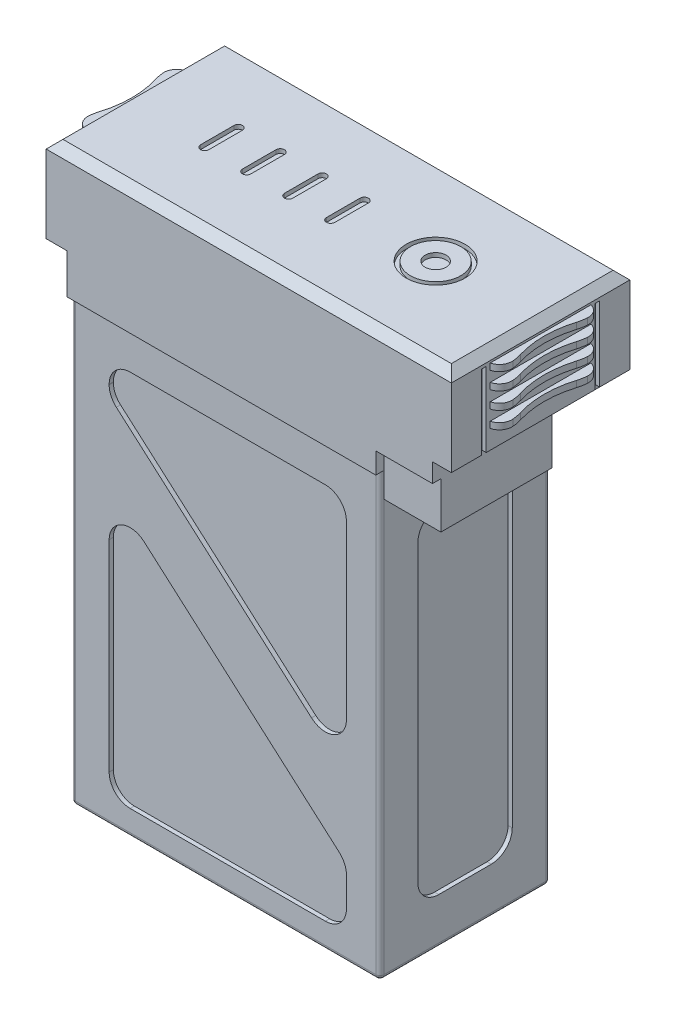
from build123d import *

# Parameters (mm, degrees)
SKETCH_1_W           = 73.5
SKETCH_1_H           = 40.5
EXTRUDE_1_DEPTH      = 135
EXTRUDE_2_DEPTH      = 1
EXTRUDE_3_DEPTH      = 1
OTHER_START          = 114.5
OTHER_1_OUTLINE_W    = 18
OTHER_1_OUTLINE_H    = 40.5
OTHER_1_DEPTH        = 20.5
OTHER_START_2        = 110
OTHER_1_2_OUTLINE_W  = 13.5
OTHER_1_2_OUTLINE_H  = 40.5
OTHER_1_2_DEPTH      = 4.5
OTHER_START_3        = -41.75
OTHER_2_OUTLINE_W    = 20.5
OTHER_2_OUTLINE_H    = 40.5
OTHER_2_DEPTH        = 5
SKETCH_4_W           = 24
SKETCH_4_H           = 1.5
EXTRUDE_4_DEPTH      = 2.3
SKETCH_5_W           = 24
SKETCH_5_H           = 1.5
EXTRUDE_5_DEPTH      = 2.3
CUT_EXTRUDE_1_DEPTH  = 18
CUT_EXTRUDE_2_DEPTH  = 18
FILLET_1_R           = 10
FILLET_2_R           = 10
FILLET_3_R           = 3
FILLET_4_R           = 3
CHAMFER_1_SIZE       = 2
SKETCH_8_W           = 1.109210869
SKETCH_8_H           = 17.780563028
CUT_EXTRUDE_3_DEPTH  = 1
SKETCH_9_W           = 1.109210869
SKETCH_9_H           = 17.780563028
CUT_EXTRUDE_4_DEPTH  = 1
FILLET_5_R           = 1
FILLET_6_R           = 1
SKETCH_10_W          = 13.5
SKETCH_10_H          = 26.5
EXTRUDE_6_DEPTH      = 11
SKETCH_11_W          = 3.601924373
SKETCH_11_H          = 6.553501289
CUT_EXTRUDE_5_DEPTH  = 11
CUT_EXTRUDE_6_DEPTH  = 1
CUT_EXTRUDE_START    = -1
CUT_EXTRUDE_7_DEPTH  = 1
CUT_EXTRUDE_8_DEPTH  = 1
CUT_EXTRUDE_9_DEPTH  = 1
SKETCH_16_R          = 7
SKETCH_16_R_2        = 6
CUT_EXTRUDE_10_DEPTH = 1
SKETCH_20_R          = 2.5
CUT_EXTRUDE_11_DEPTH = 1


# Read off the part's stored shape, not the designer's step: 边界1, 边界2
with BuildPart() as part:
    # 草图1 → 凸台-拉伸1 (new body)
    with BuildSketch(Plane(origin=(0, 0, 0), x_dir=(1, 0, 0), z_dir=(0, 1, 0))):
        Rectangle(SKETCH_1_W, SKETCH_1_H)
    extrude(amount=EXTRUDE_1_DEPTH)

    # 草图2 → 凸台-拉伸2 (add)
    with BuildSketch(Plane.XY.offset(20.25)):
        Polygon((36.75, 135), (54.75, 135), (54.75, 114.5), (50.25, 114.5), (50.25, 110), (36.75, 110), (36.75, 105), (-21.75311528, 105), (-36.75, 105), (-36.75, 114.5), (-41.75, 114.5), (-41.75, 135), (-36.75, 135), align=None)
    extrude(amount=EXTRUDE_2_DEPTH)

    # 草图3 → 凸台-拉伸3 (add)
    with BuildSketch(Plane(origin=(0, 0, -20.25), x_dir=(-1, 0, 0), z_dir=(0, 0, -1))):
        Polygon((41.75, 135), (-54.75, 135), (-54.75, 114.5), (-50.25, 114.5), (-50.25, 110), (-36.75, 110), (-36.75, 105), (36.75, 105), (36.75, 114.5), (41.75, 114.5), align=None)
    extrude(amount=EXTRUDE_3_DEPTH)

    # 边界1 outline → 边界1 (add)
    with BuildSketch(Plane(origin=(0, 0, 0), x_dir=(1, 0, 0), z_dir=(0, 1, 0)).offset(OTHER_START)):
        with Locations((45.75, 0)):
            Rectangle(OTHER_1_OUTLINE_W, OTHER_1_OUTLINE_H)
    extrude(amount=OTHER_1_DEPTH)

    # Other 1 2 outline → Other 1 2 (add)
    with BuildSketch(Plane(origin=(0, 0, 0), x_dir=(1, 0, 0), z_dir=(0, 1, 0)).offset(OTHER_START_2)):
        with Locations((43.5, 0)):
            Rectangle(OTHER_1_2_OUTLINE_W, OTHER_1_2_OUTLINE_H)
    extrude(amount=OTHER_1_2_DEPTH)

    # 边界2 outline → 边界2 (add)
    with BuildSketch(Plane.YZ.offset(OTHER_START_3)):
        with Locations((124.75, 0)):
            Rectangle(OTHER_2_OUTLINE_W, OTHER_2_OUTLINE_H)
    extrude(amount=OTHER_2_DEPTH)

    # 草图4 → 凸台-拉伸4 (add)
    with BuildSketch(Plane(origin=(54.75, 0, 0), x_dir=(0, 0, -1), z_dir=(1, 0, 0))):
        with Locations((0, 131.75)):
            Rectangle(SKETCH_4_W, SKETCH_4_H)
        with Locations((0, 127.75)):
            Rectangle(SKETCH_4_W, SKETCH_4_H)
        with Locations((0, 123.75)):
            Rectangle(SKETCH_4_W, SKETCH_4_H)
        with Locations((0, 119.75)):
            Rectangle(SKETCH_4_W, SKETCH_4_H)
    extrude(amount=EXTRUDE_4_DEPTH)

    # 草图5 → 凸台-拉伸5 (add)
    with BuildSketch(Plane.ZY.offset(41.75)):
        with Locations((0, 131.75)):
            Rectangle(SKETCH_5_W, SKETCH_5_H)
        with Locations((0, 123.75)):
            Rectangle(SKETCH_5_W, SKETCH_5_H)
        with Locations((0, 127.75)):
            Rectangle(SKETCH_5_W, SKETCH_5_H)
        with Locations((0, 119.75)):
            Rectangle(SKETCH_5_W, SKETCH_5_H)
    extrude(amount=EXTRUDE_5_DEPTH)

    # 草图6 → 切除-拉伸1 (cut)
    with BuildSketch(Plane(origin=(0, 132.5, 0), x_dir=(1, 0, 0), z_dir=(0, 1, 0))):
        with BuildLine():
            Line((-44.05, 8), (-44.05, -8))
            ThreePointArc((-44.05, -8), (-42.613858653, 0), (-44.05, 8))
        make_face()
    extrude(amount=-CUT_EXTRUDE_1_DEPTH, mode=Mode.SUBTRACT)

    # 草图7 → 切除-拉伸2 (cut)
    with BuildSketch(Plane(origin=(0, 132.5, 0), x_dir=(1, 0, 0), z_dir=(0, 1, 0))):
        with BuildLine():
            Line((57.05, 8), (57.05, -8))
            ThreePointArc((57.05, -8), (55.613858653, 0), (57.05, 8))
        make_face()
    extrude(amount=-CUT_EXTRUDE_2_DEPTH, mode=Mode.SUBTRACT)

    # 圆角1
    fillet_1_edges = [part.edges().sort_by_distance(p)[0] for p in [
        (57.05, 119.75, 8),
        (57.05, 119.75, -8),
        (57.05, 131.75, -8),
        (57.05, 127.75, -8),
        (57.05, 123.75, -8),
        (57.05, 131.75, 8),
        (57.05, 127.75, 8),
        (57.05, 123.75, 8),
    ]]
    fillet(fillet_1_edges, radius=FILLET_1_R)

    # 圆角2
    fillet_2_edges = [part.edges().sort_by_distance(p)[0] for p in [
        (-44.05, 119.75, -8),
        (-44.05, 119.75, 8),
        (-44.05, 131.75, 8),
        (-44.05, 127.75, 8),
        (-44.05, 123.75, 8),
        (-44.05, 131.75, -8),
        (-44.05, 127.75, -8),
        (-44.05, 123.75, -8),
    ]]
    fillet(fillet_2_edges, radius=FILLET_2_R)

    # 圆角3
    # the kernel refuses this fillet: 3 mm, written as the material it takes off along each edge
    with BuildSketch(Plane(origin=(-44.05, 123.139425888, 12), x_dir=(1, 0, 0), z_dir=(0, 1, 0)), Plane(origin=(-44.05, 119.139425888, 12), x_dir=(1, 0, 0), z_dir=(0, 1, 0)), Plane(origin=(-44.05, 111.139425888, 12), x_dir=(1, 0, 0), z_dir=(0, 1, 0)), Plane(origin=(-44.05, 136.360574112, -12), x_dir=(1, 0, 0), z_dir=(0, -1, 0)), Plane(origin=(-44.05, 140.360574112, -12), x_dir=(1, 0, 0), z_dir=(0, -1, 0))) as fillet_3_piece_1:
        with BuildLine():
            CenterArc((3.020964191, 2.912080122), FILLET_3_R, 175.564566075, 80.529923678)
            Line((0.029948845, 3.14408701), (-0.26915269, 3.167287699))
            ThreePointArc((-0.26915269, 3.167287699), (-0.3, 2.370730716), (-0.3, 0))
            Line((-0.3, 0), (0, -0.3))
            ThreePointArc((0, -0.3), (1.15, -0.3), (2.227903581, -0.291208012))
            Line((2.227903581, -0.291208012), (2.3, 0))
        make_face()
    extrude(amount=17.221148223, mode=Mode.SUBTRACT)
    with BuildSketch(Plane(origin=(-44.05, 132.360574112, 12), x_dir=(1, 0, 0), z_dir=(0, -1, 0)), Plane(origin=(-44.05, 115.139425888, -12), x_dir=(1, 0, 0), z_dir=(0, 1, 0))) as fillet_3_piece_2:
        with BuildLine():
            CenterArc((3.020964191, -2.912080122), FILLET_3_R, 103.905510246, 80.529923678)
            Line((0.029948845, -3.14408701), (-0.26915269, -3.167287699))
            ThreePointArc((-0.26915269, -3.167287699), (-0.3, -2.370730716), (-0.3, 0))
            Line((-0.3, 0), (0, 0.3))
            ThreePointArc((0, 0.3), (1.15, 0.3), (2.227903581, 0.291208012))
            Line((2.227903581, 0.291208012), (2.3, 0))
        make_face()
    extrude(amount=17.221148223, mode=Mode.SUBTRACT)
    with BuildSketch(Plane(origin=(-44.05, 128.360574112, -12), x_dir=(0.009525018177513691, 0, 0.9999546359854121), z_dir=(0, -1, 0))) as fillet_3_piece_3:
        with BuildLine():
            CenterArc((2.940722757, -2.993089532), FILLET_3_R, 86.110317669, 80.529923678)
            Line((0.021907542, -2.299895663), (-0.26997398, -2.230576276))
            ThreePointArc((-0.26997398, -2.230576276), (-0.28903262, -1.152805337), (-0.299986391, -0.002857505))
            Line((-0.299986391, -0.002857505), (-0.002857505, 0.299986391))
            ThreePointArc((-0.002857505, 0.299986391), (2.367765665, 0.322567644), (3.164580333, 0.299308953))
            Line((3.164580333, 0.299308953), (3.144229645, 0))
        make_face()
    extrude(amount=17.221148223, mode=Mode.SUBTRACT)

    # 圆角4
    # the kernel refuses this fillet: 3 mm, written as the material it takes off along each edge
    with BuildSketch(Plane(origin=(57.05, 140.360574112, 12), x_dir=(-0.009525018177511517, 1.1841841711484496e-15, -0.9999546359854121), z_dir=(0, -1, 0))) as fillet_4_piece_1:
        with BuildLine():
            CenterArc((2.940722757, -2.993089532), FILLET_4_R, 86.110317669, 80.529923678)
            Line((0.021907542, -2.299895663), (-0.26997398, -2.230576276))
            ThreePointArc((-0.26997398, -2.230576276), (-0.28903262, -1.152805337), (-0.299986391, -0.002857505))
            Line((-0.299986391, -0.002857505), (-0.002857505, 0.299986391))
            ThreePointArc((-0.002857505, 0.299986391), (2.367765665, 0.322567644), (3.164580333, 0.299308953))
            Line((3.164580333, 0.299308953), (3.144229645, 0))
        make_face()
    extrude(amount=17.221148223, mode=Mode.SUBTRACT)
    with BuildSketch(Plane(origin=(57.05, 119.139425888, 12), x_dir=(-0.009525018177511448, 1.1841841711484496e-15, -0.9999546359854121), z_dir=(0, 1, 0)), Plane(origin=(57.05, 115.139425888, 12), x_dir=(-0.009525018177513648, 1.1841841711484498e-15, -0.9999546359854121), z_dir=(0, 1, 0)), Plane(origin=(57.05, 111.139425888, 12), x_dir=(-0.00952501817751586, 1.1841841711484496e-15, -0.9999546359854121), z_dir=(0, 1, 0))) as fillet_4_piece_2:
        with BuildLine():
            CenterArc((2.940722757, 2.993089532), FILLET_4_R, 193.359758652, 80.529923678)
            Line((0.021907542, 2.299895663), (-0.26997398, 2.230576276))
            ThreePointArc((-0.26997398, 2.230576276), (-0.28903262, 1.152805337), (-0.299986391, 0.002857505))
            Line((-0.299986391, 0.002857505), (-0.002857505, -0.299986391))
            ThreePointArc((-0.002857505, -0.299986391), (2.367765665, -0.322567644), (3.164580333, -0.299308953))
            Line((3.164580333, -0.299308953), (3.144229645, 0))
        make_face()
    extrude(amount=17.221148223, mode=Mode.SUBTRACT)
    with BuildSketch(Plane(origin=(57.05, 128.360574112, -12), x_dir=(-1, 0, 0), z_dir=(0, -1, 0)), Plane(origin=(57.05, 132.360574112, -12), x_dir=(-1, 0, 0), z_dir=(0, -1, 0)), Plane(origin=(57.05, 136.360574112, -12), x_dir=(-1, 0, 0), z_dir=(0, -1, 0))) as fillet_4_piece_3:
        with BuildLine():
            CenterArc((3.020964191, -2.912080122), FILLET_4_R, 103.905510246, 80.529923678)
            Line((0.029948845, -3.14408701), (-0.26915269, -3.167287699))
            ThreePointArc((-0.26915269, -3.167287699), (-0.3, -2.370730716), (-0.3, 0))
            Line((-0.3, 0), (0, 0.3))
            ThreePointArc((0, 0.3), (1.15, 0.3), (2.227903581, 0.291208012))
            Line((2.227903581, 0.291208012), (2.3, 0))
        make_face()
    extrude(amount=17.221148223, mode=Mode.SUBTRACT)
    with BuildSketch(Plane(origin=(57.05, 123.139425888, -12), x_dir=(-1, 0, 0), z_dir=(0, 1, 0))) as fillet_4_piece_4:
        with BuildLine():
            CenterArc((3.020964191, 2.912080122), FILLET_4_R, 175.564566075, 80.529923678)
            Line((0.029948845, 3.14408701), (-0.26915269, 3.167287699))
            ThreePointArc((-0.26915269, 3.167287699), (-0.3, 2.370730716), (-0.3, 0))
            Line((-0.3, 0), (0, -0.3))
            ThreePointArc((0, -0.3), (1.15, -0.3), (2.227903581, -0.291208012))
            Line((2.227903581, -0.291208012), (2.3, 0))
        make_face()
    extrude(amount=17.221148223, mode=Mode.SUBTRACT)

    # 倒角1
    chamfer_1_edges = [part.edges().sort_by_distance(p)[0] for p in [
        (-41.75, 135, 0),
        (54.75, 135, 0),
        (6.5, 135, 21.25),
        (6.5, 135, -21.25),
    ]]
    chamfer(chamfer_1_edges, length=CHAMFER_1_SIZE)

    # 草图8 → 切除-拉伸3 (cut)
    with BuildSketch(Plane(origin=(54.75, 0, 0), x_dir=(0, 0, -1), z_dir=(1, 0, 0))):
        with Locations((-13.504199932, 123.390281514)):
            Rectangle(SKETCH_8_W, SKETCH_8_H)
        with Locations((13.504199932, 123.390281514)):
            Rectangle(SKETCH_8_W, SKETCH_8_H)
    extrude(amount=-CUT_EXTRUDE_3_DEPTH, mode=Mode.SUBTRACT)

    # 草图9 → 切除-拉伸4 (cut)
    with BuildSketch(Plane.ZY.offset(41.75)):
        with Locations((13.504199932, 123.390281514)):
            Rectangle(SKETCH_9_W, SKETCH_9_H)
        with Locations((-13.504199932, 123.390281514)):
            Rectangle(SKETCH_9_W, SKETCH_9_H)
    extrude(amount=-CUT_EXTRUDE_4_DEPTH, mode=Mode.SUBTRACT)

    # 圆角5
    fillet_5_edges = [part.edges().sort_by_distance(p)[0] for p in [
        (36.75, 52.5, 20.25),
        (-36.75, 52.5, 20.25),
        (-36.75, 52.5, -20.25),
        (36.75, 52.5, -20.25),
    ]]
    fillet(fillet_5_edges, radius=FILLET_5_R)

    # 圆角6
    fillet_6_edges = [part.edges().sort_by_distance(p)[0] for p in [
        (-36.75, 0, 0),
        (0, 0, -20.25),
        (36.75, 0, 0),
        (0, 0, 20.25),
        (36.457106781, 0, 19.957106781),
        (36.457106781, 0, -19.957106781),
        (-36.457106781, 0, 19.957106781),
        (-36.457106781, 0, -19.957106781),
    ]]
    fillet(fillet_6_edges, radius=FILLET_6_R)

    # 草图10 → 凸台-拉伸6 (add)
    with BuildSketch(Plane.XZ.offset(-110)):
        with Locations((43.5, 6)):
            Rectangle(SKETCH_10_W, SKETCH_10_H)
    extrude(amount=EXTRUDE_6_DEPTH)

    # 草图11 → 切除-拉伸5 (cut)
    with BuildSketch(Plane.XZ.offset(-99)):
        with Locations((43.543777425, 1.100248809)):
            Rectangle(SKETCH_11_W, SKETCH_11_H)
        with Locations((43.543777425, 10.899751192)):
            Rectangle(SKETCH_11_W, SKETCH_11_H)
    extrude(amount=-CUT_EXTRUDE_5_DEPTH, mode=Mode.SUBTRACT)

    # 草图12 → 切除-拉伸6 (cut)
    with BuildSketch(Plane(origin=(36.75, 0, 0), x_dir=(0, 0, -1), z_dir=(1, 0, 0))):
        with BuildLine():
            Line((-6.25, 91), (6.25, 91))
            ThreePointArc((6.25, 91), (9.785533906, 89.535533906), (11.25, 86))
            Line((11.25, 86), (11.25, 16))
            ThreePointArc((11.25, 16), (9.785533906, 12.464466094), (6.25, 11))
            Line((6.25, 11), (-6.25, 11))
            ThreePointArc((-6.25, 11), (-9.785533906, 12.464466094), (-11.25, 16))
            Line((-11.25, 16), (-11.25, 86))
            ThreePointArc((-11.25, 86), (-9.785533906, 89.535533906), (-6.25, 91))
        make_face()
    extrude(amount=-CUT_EXTRUDE_6_DEPTH, mode=Mode.SUBTRACT)

    # 草图13 → 切除-拉伸7 (cut)
    with BuildSketch(Plane.ZY.offset(36.75).offset(CUT_EXTRUDE_START)):
        with BuildLine():
            Line((-6.25, 96), (6.25, 96))
            ThreePointArc((6.25, 96), (9.785533906, 94.535533906), (11.25, 91))
            Line((11.25, 91), (11.25, 16))
            ThreePointArc((11.25, 16), (9.785533906, 12.464466094), (6.25, 11))
            Line((6.25, 11), (-6.25, 11))
            ThreePointArc((-6.25, 11), (-9.785533906, 12.464466094), (-11.25, 16))
            Line((-11.25, 16), (-11.25, 91))
            ThreePointArc((-11.25, 91), (-9.785533906, 94.535533906), (-6.25, 96))
        make_face()
    extrude(amount=CUT_EXTRUDE_7_DEPTH, mode=Mode.SUBTRACT)

    # 草图14 → 切除-拉伸8 (cut)
    with BuildSketch(Plane.XY.offset(20.25)):
        with BuildLine():
            Line((-22.75, 96), (23.75, 96))
            ThreePointArc((23.75, 96), (27.285533906, 94.535533906), (28.75, 91))
            Line((28.75, 91), (28.75, 50.03941798))
            ThreePointArc((28.75, 50.03941798), (25.812401045, 45.484585169), (20.451399228, 46.281861201))
            Line((20.451399228, 46.281861201), (-23.131958919, 84.541854947))
            Line((-23.131958919, 84.541854947), (-26.048600772, 87.102251939))
            ThreePointArc((-26.048600772, 87.102251939), (-27.30483281, 88.797407673), (-27.75, 90.859808717))
            Line((-27.75, 90.859808717), (-27.75, 91))
            ThreePointArc((-27.75, 91), (-26.285533906, 94.535533906), (-22.75, 96))
        make_face()
        with BuildLine():
            Line((-22.75, 6), (23.75, 6))
            ThreePointArc((23.75, 6), (27.285533906, 7.464466094), (28.75, 11))
            Line((28.75, 11), (28.75, 18.103772806))
            ThreePointArc((28.75, 18.103772806), (28.30483281, 20.16617385), (27.048600772, 21.861329584))
            Line((27.048600772, 21.861329584), (24.131958919, 24.421726576))
            Line((24.131958919, 24.421726576), (-19.451399228, 62.681720322))
            ThreePointArc((-19.451399228, 62.681720322), (-24.812401045, 63.478996354), (-27.75, 58.924163544))
            Line((-27.75, 58.924163544), (-27.75, 11))
            ThreePointArc((-27.75, 11), (-26.285533906, 7.464466094), (-22.75, 6))
        make_face()
    extrude(amount=-CUT_EXTRUDE_8_DEPTH, mode=Mode.SUBTRACT)

    # 草图15 → 切除-拉伸9 (cut)
    with BuildSketch(Plane(origin=(0, 0, -20.25), x_dir=(-1, 0, 0), z_dir=(0, 0, -1)).offset(CUT_EXTRUDE_START)):
        with BuildLine():
            Line((-20.451399228, 46.281861201), (26.048600772, 87.102251939))
            ThreePointArc((26.048600772, 87.102251939), (27.30483281, 88.797407673), (27.75, 90.859808717))
            Line((27.75, 90.859808717), (27.75, 91))
            ThreePointArc((27.75, 91), (26.285533906, 94.535533906), (22.75, 96))
            Line((22.75, 96), (-23.75, 96))
            ThreePointArc((-23.75, 96), (-27.285533906, 94.535533906), (-28.75, 91))
            Line((-28.75, 91), (-28.75, 50.03941798))
            ThreePointArc((-28.75, 50.03941798), (-25.812401045, 45.484585169), (-20.451399228, 46.281861201))
        make_face()
        with BuildLine():
            Line((19.451399228, 62.681720322), (-27.048600772, 21.861329584))
            ThreePointArc((-27.048600772, 21.861329584), (-28.30483281, 20.16617385), (-28.75, 18.103772806))
            Line((-28.75, 18.103772806), (-28.75, 11))
            ThreePointArc((-28.75, 11), (-27.285533906, 7.464466094), (-23.75, 6))
            Line((-23.75, 6), (22.75, 6))
            ThreePointArc((22.75, 6), (26.285533906, 7.464466094), (27.75, 11))
            Line((27.75, 11), (27.75, 58.924163544))
            ThreePointArc((27.75, 58.924163544), (24.812401045, 63.478996354), (19.451399228, 62.681720322))
        make_face()
    extrude(amount=CUT_EXTRUDE_9_DEPTH, mode=Mode.SUBTRACT)

    # 草图16 → 切除-拉伸10 (cut)
    # profile 1 of 5: a face of its own
    with BuildSketch(Plane(origin=(0, 135, 0), x_dir=(1, 0, 0), z_dir=(0, 1, 0))):
        with Locations(Location((29.75, 0, 0), (0, 0, 90))):
            Circle(SKETCH_16_R)
        with Locations(Location((29.75, 0, 0), (0, 0, 270))):
            Circle(SKETCH_16_R_2, mode=Mode.SUBTRACT)
    # profile 2 of 5: a face of its own
    with BuildSketch(Plane(origin=(0, 135, 0), x_dir=(1, 0, 0), z_dir=(0, 1, 0))):
        with BuildLine():
            Line((-20.25, -4), (-20.25, 4))
            ThreePointArc((-20.25, 4), (-21.25, 5), (-22.25, 4))
            Line((-22.25, 4), (-22.25, -4))
            ThreePointArc((-22.25, -4), (-21.25, -5), (-20.25, -4))
        make_face()
    # profile 3 of 5: a face of its own
    with BuildSketch(Plane(origin=(0, 135, 0), x_dir=(1, 0, 0), z_dir=(0, 1, 0))):
        with BuildLine():
            Line((-10.25, -4), (-10.25, 4))
            ThreePointArc((-10.25, 4), (-11.25, 5), (-12.25, 4))
            Line((-12.25, 4), (-12.25, -4))
            ThreePointArc((-12.25, -4), (-11.25, -5), (-10.25, -4))
        make_face()
    # profile 4 of 5: a face of its own
    with BuildSketch(Plane(origin=(0, 135, 0), x_dir=(1, 0, 0), z_dir=(0, 1, 0))):
        with BuildLine():
            Line((-0.25, -4), (-0.25, 4))
            ThreePointArc((-0.25, 4), (-1.25, 5), (-2.25, 4))
            Line((-2.25, 4), (-2.25, -4))
            ThreePointArc((-2.25, -4), (-1.25, -5), (-0.25, -4))
        make_face()
    # profile 5 of 5: a face of its own
    with BuildSketch(Plane(origin=(0, 135, 0), x_dir=(1, 0, 0), z_dir=(0, 1, 0))):
        with BuildLine():
            Line((9.75, -4), (9.75, 4))
            ThreePointArc((9.75, 4), (8.75, 5), (7.75, 4))
            Line((7.75, 4), (7.75, -4))
            ThreePointArc((7.75, -4), (8.75, -5), (9.75, -4))
        make_face()
    extrude(amount=-CUT_EXTRUDE_10_DEPTH, mode=Mode.SUBTRACT)

    # 草图20 → 切除-拉伸11 (cut)
    with BuildSketch(Plane(origin=(0, 135, 0), x_dir=(1, 0, 0), z_dir=(0, 1, 0))):
        with Locations(Location((29.75, 0, 0), (0, 0, 270))):
            Circle(SKETCH_20_R)
    extrude(amount=-CUT_EXTRUDE_11_DEPTH, mode=Mode.SUBTRACT)


solid = part.part
